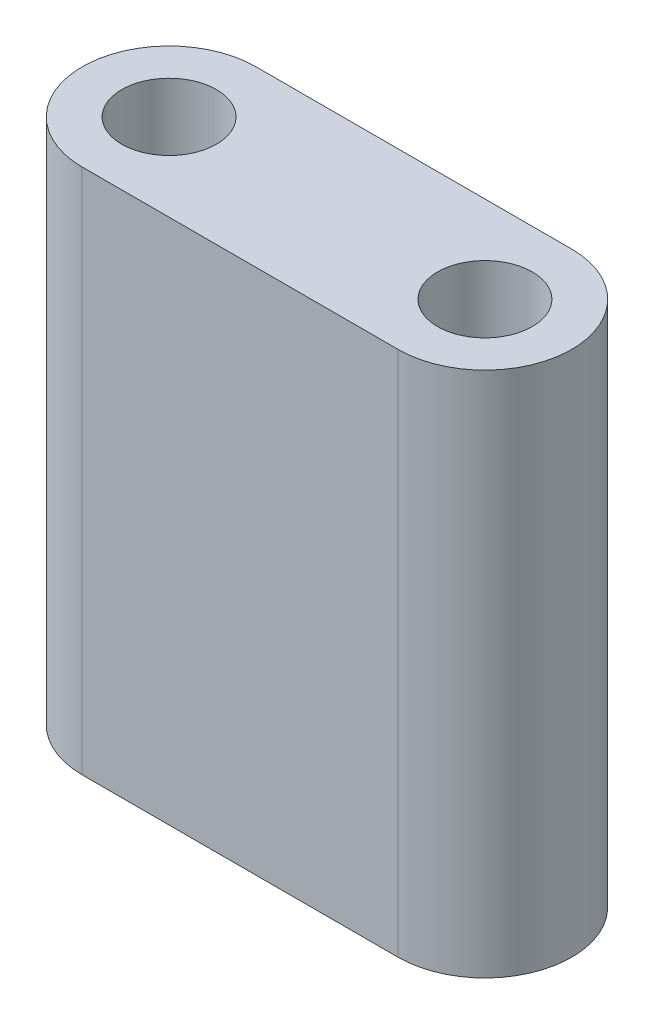
from build123d import *

# Parameters (mm, degrees)
SKETCH1_R           = 1.8
BOSS_EXTRUDE1_DEPTH = 20


with BuildPart() as part:
    # Sketch1 → Boss-Extrude1 (new body)
    with BuildSketch(Plane(origin=(0, 0, 0), x_dir=(1, 0, 0), z_dir=(0, 1, 0))):
        with BuildLine():
            Line((0, 3.3), (12, 3.3))
            ThreePointArc((12, 3.3), (15.3, 0), (12, -3.3))
            Line((12, -3.3), (0, -3.3))
            ThreePointArc((0, -3.3), (-3.3, 0), (0, 3.3))
        make_face()
        Circle(SKETCH1_R, mode=Mode.SUBTRACT)
        with Locations((12, 0)):
            Circle(SKETCH1_R, mode=Mode.SUBTRACT)
    extrude(amount=BOSS_EXTRUDE1_DEPTH)


solid = part.part
